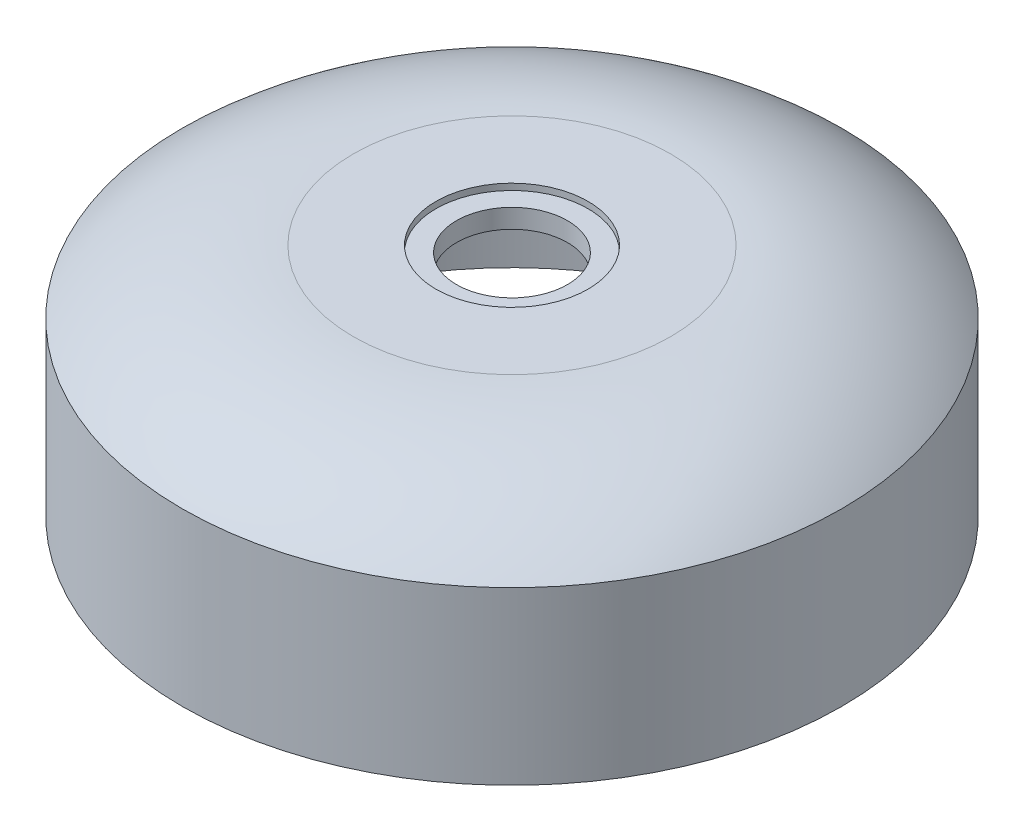
from build123d import *
from build123d.topology import SkipClean

# Parameters (mm, degrees)
SKETCH1_R                       = 26
SKETCH3_R                       = 12.5
SKETCH8_R                       = 26
BOSS_EXTRUDE1_DEPTH             = 13.5
CUT_EXTRUDE1_START              = -4
SKETCH10_R                      = 24
CUT_EXTRUDE1_DEPTH              = 4
SKETCH9_R                       = 4.375
CUT_EXTRUDE2_DEPTH              = 4
BOSS_EXTRUDE5_REACH             = 41.17
BOSS_EXTRUDE5_END_MAJOR_RADIUS  = 13
BOSS_EXTRUDE5_END_MINOR_RADIUS  = 17.381450539
SKETCH18_R                      = 3
BOSS_EXTRUDE5_DIRECTION_2_DEPTH = 1.65
M3X0_5_TAPPED_HOLE1_D           = 2.5
M3X0_5_TAPPED_HOLE1_DEPTH       = 4
M3X0_5_TAPPED_HOLE1_CSINK_D     = 3.05
M3X0_5_TAPPED_HOLE1_CSINK_ANGLE = 90
M3X0_5_TAPPED_HOLE1_TIP         = 0.751075774
SKETCH32_R                      = 3
SKETCH32_R_2                    = 2
BOSS_EXTRUDE6_DEPTH             = 1.6
SKETCH35_R                      = 6
CUT_EXTRUDE3_DEPTH              = 0.5


# Read off the part's stored shape, not the designer's step: Shell4
with BuildPart() as part:
    # Sketch1 → Loft2 section 0
    with BuildSketch(Plane(origin=(0, 0, 0), x_dir=(1, 0, 0), z_dir=(0, 1, 0))):
        Circle(SKETCH1_R)
    # Sketch3 → Loft2 section 1
    with BuildSketch(Plane(origin=(0, 5, 0), x_dir=(1, 0, 0), z_dir=(0, 1, 0))):
        Circle(SKETCH3_R)
    loft()

    # Sketch6<5> → Revolve1 (revolve)
    with BuildSketch(Plane(origin=(0, 0, 0), x_dir=(0, 0, -1), z_dir=(1, 0, 0)), mode=Mode.PRIVATE) as revolve1_sk:
        with BuildLine():
            Line((-26, 0), (-12.5, 0))
            Line((-12.5, 0), (-12.5, 5))
            ThreePointArc((-12.5, 5), (-19.731456009, 3.799931224), (-26, 0))
        make_face()
    revolve(revolve1_sk.sketch.rotate(Axis((0, 0, 0), (0, 1, 0)), 180), axis=Axis((0, 0, 0), (0, 1, 0)))

    # Sketch8 → Boss-Extrude1 (add)
    with BuildSketch(Plane.XZ):
        with Locations(Location((0, 0, 0), (0, 0, 270))):
            Circle(SKETCH8_R)
    extrude(amount=BOSS_EXTRUDE1_DEPTH)

    # Shell4 outline → Shell4 (revolve, cut)
    with BuildSketch(Plane.XY):
        with BuildLine():
            ThreePointArc((24, -0.917109272), (18.615849118, 2.074226776), (12.526504653, 3))
            Line((12.526504653, 3), (0, 3))
            Line((0, 3), (0, -11.5))
            Line((0, -11.5), (24, -11.5))
            Line((24, -11.5), (24, -0.917109272))
        make_face()
    revolve(axis=Axis((0, 0, 0), (0, 1, 0)), mode=Mode.SUBTRACT)

    # Sketch10 → Cut-Extrude1 (cut)
    with SkipClean():  # the faces are left unmerged after this step: merging them gives an invalid solid
        with BuildSketch(Plane.XZ.offset(13.5).offset(CUT_EXTRUDE1_START)):
            with Locations(Location((0, 0, 0), (0, 0, 270))):
                Circle(SKETCH10_R)
        extrude(amount=CUT_EXTRUDE1_DEPTH, mode=Mode.SUBTRACT)

    # Sketch9 → Cut-Extrude2 (cut)
    with SkipClean():  # the faces are left unmerged after this step: merging them gives an invalid solid
        with BuildSketch(Plane(origin=(0, 5, 0), x_dir=(1, 0, 0), z_dir=(0, 1, 0))):
            with Locations(Location((0, 0, 0), (0, 0, 270))):
                Circle(SKETCH9_R)
        extrude(amount=-CUT_EXTRUDE2_DEPTH, mode=Mode.SUBTRACT)

    # Boss-Extrude5: up to this torus (the profile starts inside it)
    with SkipClean():  # the faces are left unmerged after this step: merging them gives an invalid solid
        boss_extrude5_end = Plane(origin=(0, -14.375, 0), z_dir=(0, -1, 0)) * Torus(BOSS_EXTRUDE5_END_MAJOR_RADIUS, BOSS_EXTRUDE5_END_MINOR_RADIUS, mode=Mode.PRIVATE)
        # Sketch18 → Boss-Extrude5 (add, up to the surface)
        with BuildSketch(Plane(origin=(0, 0, 0), x_dir=(1, 0, 0), z_dir=(0, 1, 0)), mode=Mode.PRIVATE) as boss_extrude5_sk1:
            with Locations(Location((0, -20.2, 0), (0, 0, 270))):
                Circle(SKETCH18_R)
        boss_extrude5_tool1 = extrude(boss_extrude5_sk1.sketch, amount=BOSS_EXTRUDE5_REACH, mode=Mode.PRIVATE) & boss_extrude5_end
        add(boss_extrude5_tool1.solids().sort_by_distance((0, 0, 20.2))[0])
        # Sketch18 → Boss-Extrude5 (add, up to the surface)
        with BuildSketch(Plane(origin=(0, 0, 0), x_dir=(1, 0, 0), z_dir=(0, 1, 0)), mode=Mode.PRIVATE) as boss_extrude5_sk2:
            with Locations(Location((0, 20.2, 0), (0, 0, 270))):
                Circle(SKETCH18_R)
        boss_extrude5_tool2 = extrude(boss_extrude5_sk2.sketch, amount=BOSS_EXTRUDE5_REACH, mode=Mode.PRIVATE) & boss_extrude5_end
        add(boss_extrude5_tool2.solids().sort_by_distance((0, 0, -20.2))[0])

    # Sketch18 → Boss-Extrude5 direction 2 (add)
    with SkipClean():  # the faces are left unmerged after this step: merging them gives an invalid solid
        with BuildSketch(Plane(origin=(0, 0, 0), x_dir=(1, 0, 0), z_dir=(0, 1, 0))):
            with Locations(Location((0, -20.2, 0), (0, 0, 270))):
                Circle(SKETCH18_R)
            with Locations(Location((0, 20.2, 0), (0, 0, 270))):
                Circle(SKETCH18_R)
        extrude(amount=-BOSS_EXTRUDE5_DIRECTION_2_DEPTH)
    add(part.part.scale(1), mode=Mode.REPLACE)  # the faces are merged on a copy

    # M3x0.5 Tapped Hole1
    with Locations(Plane(origin=(0, -1.65, 0), x_dir=(-1, 0, 0), z_dir=(0, -1, 0))):
        with Locations((0, -20.2), (0, 20.2)):
            CounterSinkHole(M3X0_5_TAPPED_HOLE1_D / 2, M3X0_5_TAPPED_HOLE1_CSINK_D / 2, depth=M3X0_5_TAPPED_HOLE1_DEPTH, counter_sink_angle=M3X0_5_TAPPED_HOLE1_CSINK_ANGLE)
            with Locations((0, 0, -(M3X0_5_TAPPED_HOLE1_DEPTH + M3X0_5_TAPPED_HOLE1_TIP / 2))):  # 118° drill point
                Cone(0, M3X0_5_TAPPED_HOLE1_D / 2, M3X0_5_TAPPED_HOLE1_TIP, mode=Mode.SUBTRACT)

    # Sketch32 → Boss-Extrude6 (add)
    # profile 1 of 2: a face of its own
    with SkipClean():  # the faces are left unmerged after this step: merging them gives an invalid solid
        with BuildSketch(Plane.XZ.offset(1.65)):
            with Locations(Location((0, -20.2, 0), (0, 0, 90))):
                Circle(SKETCH32_R)
            with Locations(Location((0, -20.2, 0), (0, 0, 270))):
                Circle(SKETCH32_R_2, mode=Mode.SUBTRACT)
        # profile 2 of 2: a face of its own
        with BuildSketch(Plane.XZ.offset(1.65)):
            with Locations(Location((0, 20.2, 0), (0, 0, 90))):
                Circle(SKETCH32_R)
            with Locations(Location((0, 20.2, 0), (0, 0, 90))):
                Circle(SKETCH32_R_2, mode=Mode.SUBTRACT)
        extrude(amount=BOSS_EXTRUDE6_DEPTH)

    # Sketch35 → Cut-Extrude3 (cut)
    with SkipClean():  # the faces are left unmerged after this step: merging them gives an invalid solid
        with BuildSketch(Plane(origin=(0, 5, 0), x_dir=(1, 0, 0), z_dir=(0, 1, 0))):
            with Locations(Location((0, 0, 0), (0, 0, 270))):
                Circle(SKETCH35_R)
        extrude(amount=-CUT_EXTRUDE3_DEPTH, mode=Mode.SUBTRACT)


solid = part.part
